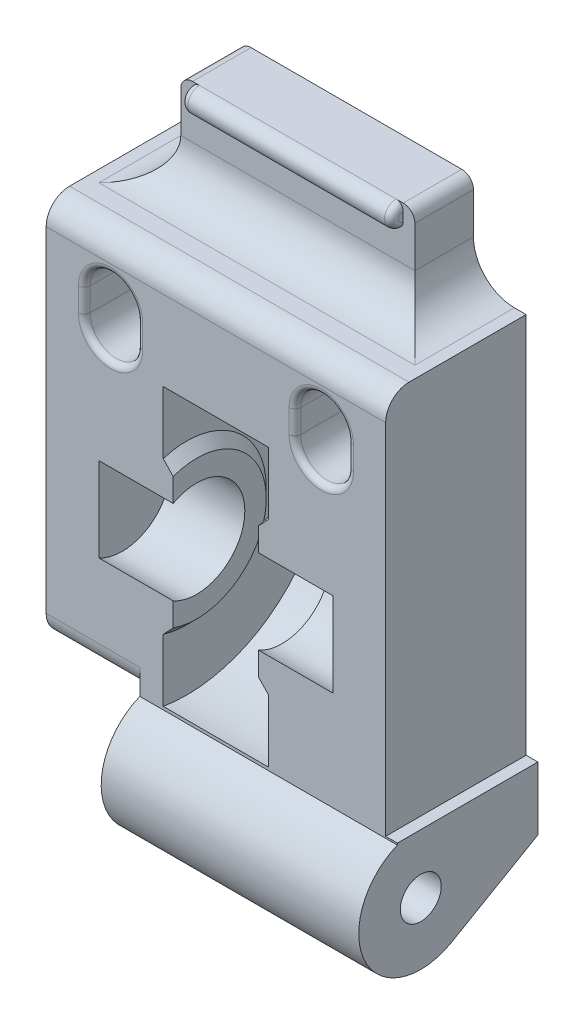
from build123d import *

# Parameters (mm, degrees)
BOSS_EXTRUDE1_DEPTH = 16
SKETCH2_R           = 12
CUT_EXTRUDE1_DEPTH  = 4.5
SKETCH6_R           = 1.75
CUT_EXTRUDE4_DEPTH  = 17.5
BOSS_EXTRUDE2_DEPTH = 0.85
BOSS_EXTRUDE3_START = 0.85
BOSS_EXTRUDE3_DEPTH = 0.85
SKETCH3_R           = 4.12
BEARING_AXIS_DEPTH  = 10
CHAMFER1_SIZE       = 0.85
SKETCH15_W          = 20
SKETCH15_H          = 5
BOSS_EXTRUDE4_DEPTH = 8
FILLET1_R           = 3.5
FILLET3_R           = 1
SKETCH16_R          = 1
BOSS_EXTRUDE5_DEPTH = 9
FILLET4_R           = 0.6
CUT_EXTRUDE8_DEPTH  = 12
FILLET6_R           = 0.5
SKETCH19_W          = 12
SKETCH19_H          = 32.6
CUT_EXTRUDE9_DEPTH  = 1.5
SKETCH20_W          = 12
SKETCH20_H          = 32.6
CUT_EXTRUDE10_DEPTH = 1.5
SKETCH21_W          = 16.964448298
SKETCH21_H          = 10.992811929
CUT_EXTRUDE11_DEPTH = 9.5
SKETCH22_W          = 17.37165941
SKETCH22_H          = 11.278055293
CUT_EXTRUDE12_DEPTH = 0.5
FILLET7_R           = 2


with BuildPart() as part:
    # Sketch1 → Boss-Extrude1 (new, symmetric)
    with BuildSketch(Plane(origin=(0, 0, 0), x_dir=(0, 0, -1), z_dir=(1, 0, 0))):
        with BuildLine():
            Line((10, -0.346), (2.551698211, -4.645302599))
            ThreePointArc((2.551698211, -4.645302599), (-4.784687849, -2.279640803), (-2, 4.908156477))
            Line((-2, 4.908156477), (-2, 37.654))
            Line((-2, 37.654), (10, 37.654))
            Line((10, 37.654), (10, -0.346))
        make_face()
    extrude(amount=BOSS_EXTRUDE1_DEPTH, both=True)

    # Sketch2 → Cut-Extrude1 (cut, symmetric)
    with BuildSketch(Plane(origin=(0, 0, 0), x_dir=(0, 0, -1), z_dir=(1, 0, 0))):
        with Locations((0, 17)):
            Circle(SKETCH2_R)
    extrude(amount=CUT_EXTRUDE1_DEPTH, both=True, mode=Mode.SUBTRACT)

    # Sketch6 → Cut-Extrude4 (cut, symmetric)
    with BuildSketch(Plane(origin=(0, 0, 0), x_dir=(0, 0, -1), z_dir=(1, 0, 0))):
        Circle(SKETCH6_R)
    extrude(amount=CUT_EXTRUDE4_DEPTH, both=True, mode=Mode.SUBTRACT)

    # Sketch8 → Boss-Extrude2 (add)
    with BuildSketch(Plane(origin=(-4.5, 0, 0), x_dir=(0, 0, -1), z_dir=(1, 0, 0))):
        with BuildLine():
            Line((-2, 23.499230724), (-2, 10.500769276))
            ThreePointArc((-2, 10.500769276), (6.8, 17), (-2, 23.499230724))
        make_face()
    extrude(amount=BOSS_EXTRUDE2_DEPTH)

    # Sketch9 → Boss-Extrude3 (add)
    with BuildSketch(Plane.ZY.offset(-4.5).offset(BOSS_EXTRUDE3_START)):
        with BuildLine():
            Line((2, 23.499230724), (2, 10.500769276))
            ThreePointArc((2, 10.500769276), (-6.8, 17), (2, 23.499230724))
        make_face()
    extrude(amount=-BOSS_EXTRUDE3_DEPTH)

    # Sketch3 → bearing_axis (cut, symmetric)
    with BuildSketch(Plane(origin=(0, 0, 0), x_dir=(0, 0, -1), z_dir=(1, 0, 0))):
        with Locations((0, 17)):
            Circle(SKETCH3_R)
    extrude(amount=BEARING_AXIS_DEPTH, both=True, mode=Mode.SUBTRACT)

    # Chamfer1
    chamfer1_edges = [part.edges().sort_by_distance(p)[0] for p in [
        (3.65, 17, -6.8),
        (-3.65, 17, -6.8),
    ]]
    chamfer(chamfer1_edges, length=CHAMFER1_SIZE - 0.0001)  # a hair under: the kernel refuses the full size

    # Sketch15 → Boss-Extrude4 (add)
    with BuildSketch(Plane(origin=(0, 37.654, 0), x_dir=(1, 0, 0), z_dir=(0, 1, 0))):
        with Locations((0, 7.5)):
            Rectangle(SKETCH15_W, SKETCH15_H)
    extrude(amount=BOSS_EXTRUDE4_DEPTH)

    # Fillet1
    fillet1_edges = [part.edges().sort_by_distance(p)[0] for p in [
        (0, 37.654, -5),
        (10, 37.654, -7.5),
        (-10, 37.654, -7.5),
    ]]
    fillet(fillet1_edges, radius=FILLET1_R)

    # Fillet3
    fillet3_edges = [part.edges().sort_by_distance(p)[0] for p in [
        (-10, 45.654, -7.5),
        (10, 45.654, -7.5),
    ]]
    fillet(fillet3_edges, radius=FILLET3_R)

    # Sketch16 → Boss-Extrude5 (add, symmetric)
    with BuildSketch(Plane(origin=(0, 0, 0), x_dir=(0, 0, -1), z_dir=(1, 0, 0))):
        with Locations((5, 44.654)):
            Circle(SKETCH16_R)
    extrude(amount=BOSS_EXTRUDE5_DEPTH, both=True)

    # Fillet4
    fillet4_edges = [part.edges().sort_by_distance(p)[0] for p in [
        (-9, 44.654, -4),
        (9, 44.654, -4),
    ]]
    fillet(fillet4_edges, radius=FILLET4_R)

    # Sketch18 → Cut-Extrude8 (cut)
    with BuildSketch(Plane.XY.offset(-10)):
        with BuildLine():
            Line((-11.25, 30.654), (-11.25, 32.654))
            ThreePointArc((-11.25, 32.654), (-9, 34.904), (-6.75, 32.654))
            Line((-6.75, 32.654), (-6.75, 30.654))
            ThreePointArc((-6.75, 30.654), (-9, 28.404), (-11.25, 30.654))
        make_face()
        with BuildLine():
            Line((11.25, 32.654), (11.25, 30.654))
            ThreePointArc((11.25, 30.654), (9, 28.404), (6.75, 30.654))
            Line((6.75, 30.654), (6.75, 32.654))
            ThreePointArc((6.75, 32.654), (9, 34.904), (11.25, 32.654))
        make_face()
    extrude(amount=CUT_EXTRUDE8_DEPTH, mode=Mode.SUBTRACT)

    # Fillet6
    fillet6_edges = [part.edges().sort_by_distance(p)[0] for p in [
        (-11.25, 31.654, 2),
        (-9, 34.904, 2),
        (-6.75, 31.654, 2),
        (-9, 28.404, 2),
        (11.25, 31.654, 2),
        (9, 28.404, 2),
        (6.75, 31.654, 2),
        (9, 34.904, 2),
    ]]
    fillet(fillet6_edges, radius=FILLET6_R)

    # Sketch19 → Cut-Extrude9 (cut)
    with BuildSketch(Plane(origin=(16, 0, 0), x_dir=(0, 0, -1), z_dir=(1, 0, 0))):
        with Locations((4, 21.354)):
            Rectangle(SKETCH19_W, SKETCH19_H)
    extrude(amount=-CUT_EXTRUDE9_DEPTH, mode=Mode.SUBTRACT)

    # Sketch20 → Cut-Extrude10 (cut)
    with BuildSketch(Plane.ZY.offset(16)):
        with Locations((-4, 21.354)):
            Rectangle(SKETCH20_W, SKETCH20_H)
    extrude(amount=-CUT_EXTRUDE10_DEPTH, mode=Mode.SUBTRACT)

    # Sketch21 → Cut-Extrude11 (cut)
    with BuildSketch(Plane.ZY.offset(16)):
        with Locations((-1.517775851, -0.442405965)):
            Rectangle(SKETCH21_W, SKETCH21_H)
    extrude(amount=-CUT_EXTRUDE11_DEPTH, mode=Mode.SUBTRACT)

    # Sketch22 → Cut-Extrude12 (cut)
    with BuildSketch(Plane(origin=(16, 0, 0), x_dir=(0, 0, -1), z_dir=(1, 0, 0))):
        with Locations((1.314170295, -0.585027646)):
            Rectangle(SKETCH22_W, SKETCH22_H)
    extrude(amount=-CUT_EXTRUDE12_DEPTH, mode=Mode.SUBTRACT)

    # Fillet7
    fillet7_edges = [part.edges().sort_by_distance(p)[0] for p in [
        (0, 37.654, 2),
        (-10.5, 5.054, 2),
    ]]
    fillet(fillet7_edges, radius=FILLET7_R)


solid = part.part
